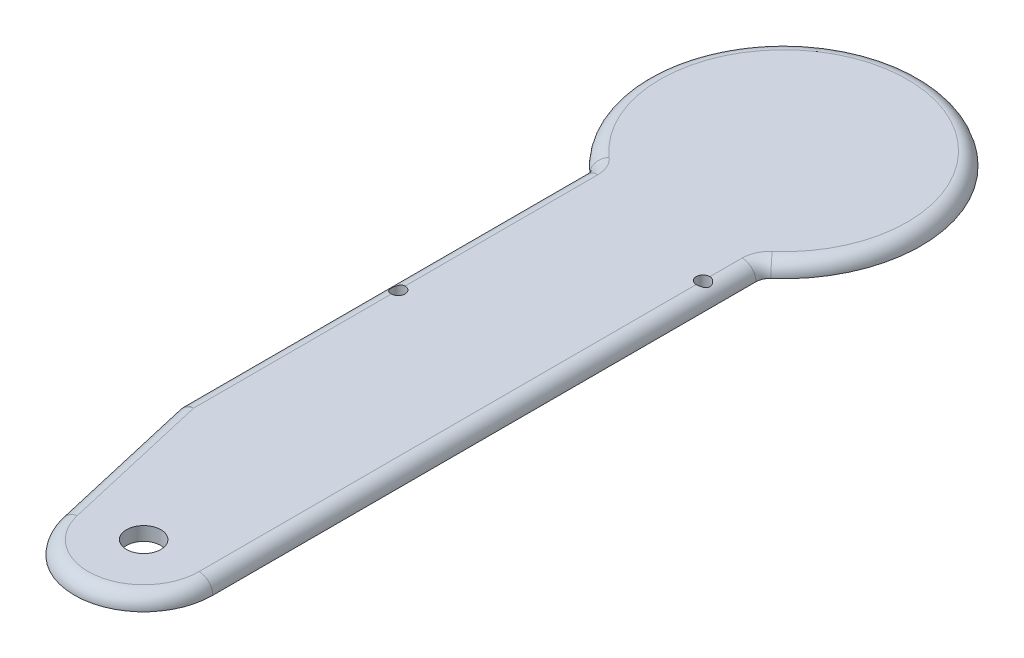
from build123d import *

# Parameters (mm, degrees)
SKETCH1_R           = 3.175
SKETCH1_R_2         = 1.27
BOSS_EXTRUDE1_DEPTH = 2.54
FILLET1_R           = 2.54
FILLET2_R           = 2.54


with BuildPart() as part:
    # Sketch1 → Boss-Extrude1 (new body)
    with BuildSketch(Plane(origin=(0, 0, 0), x_dir=(1, 0, 0), z_dir=(0, 1, 0))):
        with BuildLine():
            Line((-15.875, -19.827868645), (-15.875, -96.027868645))
            Line((-15.875, -96.027868645), (-9.362396438, -124.297332186))
            ThreePointArc((-9.362396438, -124.297332186), (4.537150087, -134.127868645), (15.875, -121.427868645))
            Line((15.875, -121.427868645), (15.875, -96.027868645))
            Line((15.875, -96.027868645), (15.875, -19.827868645))
            ThreePointArc((15.875, -19.827868645), (0, 25.4), (-15.875, -19.827868645))
        make_face()
        with Locations(Location((3.093174395, -121.427868645, 0), (0, 0, 270))):
            Circle(SKETCH1_R, mode=Mode.SUBTRACT)
        with Locations(Location((-13.335, -57.927868645, 0), (0, 0, 270))):
            Circle(SKETCH1_R_2, mode=Mode.SUBTRACT)
        with Locations(Location((13.335, -28.25059986, 0), (0, 0, 270))):
            Circle(SKETCH1_R_2, mode=Mode.SUBTRACT)
    extrude(amount=BOSS_EXTRUDE1_DEPTH)

    # Fillet1
    fillet1_edges = [part.edges().sort_by_distance(p)[0] for p in [
        (15.875, 1.27, 19.827868645),
        (-15.875, 1.27, 96.027868645),
        (-15.875, 1.27, 19.827868645),
    ]]
    fillet(fillet1_edges, radius=FILLET1_R)

    # Fillet2
    # the kernel refuses this fillet: 2.54 mm, written as the material it takes off along each edge
    with BuildSketch(Plane(origin=(-18.415, 2.54, 21.012647977), x_dir=(1, 0, 0), z_dir=(0, 0, 1))) as fillet2_piece_1:
        with BuildLine():
            CenterArc((2.54 + FILLET2_R, -FILLET2_R), FILLET2_R, 90, 90)
            Line((2.54 + FILLET2_R, 0), (2.54, 0))
            Line((2.54, 0), (2.54, -FILLET2_R))
        make_face()
    revolve(axis=Axis((-18.415, 2.54, 21.012647977), (0, 1, 0)), revolution_arc=48.769422845, mode=Mode.SUBTRACT)
    with BuildSketch(Plane(origin=(0, 2.54, 0), x_dir=(0.6590909090909091, 0, 0.7520632776261045), z_dir=(-0.7520632776261045, 0, 0.6590909090909091))) as fillet2_piece_2:
        with BuildLine():
            CenterArc((25.4 - FILLET2_R, -FILLET2_R), FILLET2_R, 0, 90)
            Line((25.4, -FILLET2_R), (25.4, 0))
            Line((25.4, 0), (25.4 - FILLET2_R, 0))
        make_face()
    revolve(axis=Axis((0, 2.54, 0), (0, 1, 0)), revolution_arc=277.53884569, mode=Mode.SUBTRACT)
    with BuildSketch(Plane(origin=(18.415, 2.54, 21.012647977), x_dir=(-1, 0, 0), z_dir=(0, 0, 1))) as fillet2_piece_3:
        with BuildLine():
            CenterArc((2.54 + FILLET2_R, FILLET2_R), FILLET2_R, 180, 90)
            Line((2.54, FILLET2_R), (2.54, 0))
            Line((2.54, 0), (2.54 + FILLET2_R, 0))
        make_face()
    revolve(axis=Axis((18.415, 2.54, 21.012647977), (0, -1, 0)), revolution_arc=48.769422845, mode=Mode.SUBTRACT)
    with BuildSketch(Plane(origin=(15.875, 2.54, 21.012647977), x_dir=(-1, 0, 0), z_dir=(0, 0, 1))) as fillet2_piece_4:
        with BuildLine():
            CenterArc((FILLET2_R, FILLET2_R), FILLET2_R, 180, 90)
            Line((0, FILLET2_R), (0, 0))
            Line((0, 0), (FILLET2_R, 0))
        make_face()
    extrude(amount=100.415220668, mode=Mode.SUBTRACT)
    with BuildSketch(Plane(origin=(3.093174395, 2.54, 121.427868645), x_dir=(-0.9744751037997539, 0, 0.2244955947774008), z_dir=(-0.2244955947774008, 0, -0.9744751037997539))) as fillet2_piece_5:
        with BuildLine():
            CenterArc((12.781825605 - FILLET2_R, -FILLET2_R), FILLET2_R, 0, 90)
            Line((12.781825605, -FILLET2_R), (12.781825605, 0))
            Line((12.781825605, 0), (12.781825605 - FILLET2_R, 0))
        make_face()
    revolve(axis=Axis((3.093174395, 2.54, 121.427868645), (0, 1, 0)), revolution_arc=167.026780897, mode=Mode.SUBTRACT)
    with BuildSketch(Plane(origin=(-15.810166764, 2.54, 96.309292317), x_dir=(0.9744751037997537, 0, -0.22449559477740183), z_dir=(0.22449559477740183, 0, 0.9744751037997537))) as fillet2_piece_6:
        with BuildLine():
            CenterArc((FILLET2_R, -FILLET2_R), FILLET2_R, 90, 90)
            Line((0, -FILLET2_R), (0, 0))
            Line((0, 0), (FILLET2_R, 0))
        make_face()
    extrude(amount=28.721144091, mode=Mode.SUBTRACT)
    with BuildSketch(Plane(origin=(-13.335, 2.54, 95.739073507), x_dir=(-1, 0, 0), z_dir=(0, 0, -1))) as fillet2_piece_7:
        with BuildLine():
            CenterArc((2.54 - FILLET2_R, -FILLET2_R), FILLET2_R, 0, 90)
            Line((2.54 - FILLET2_R, 0), (2.54, 0))
            Line((2.54, 0), (2.54, -FILLET2_R))
        make_face()
    revolve(axis=Axis((-13.335, 2.54, 95.739073507), (0, 1, 0)), revolution_arc=12.973219103, mode=Mode.SUBTRACT)
    with BuildSketch(Plane(origin=(-15.875, 2.54, 21.012647977), x_dir=(0, -1, 0), z_dir=(0, 0, 1))) as fillet2_piece_8:
        with BuildLine():
            CenterArc((FILLET2_R, FILLET2_R), FILLET2_R, 180, 90)
            Line((0, FILLET2_R), (0, 0))
            Line((0, 0), (FILLET2_R, 0))
        make_face()
    extrude(amount=74.72642553, mode=Mode.SUBTRACT)


solid = part.part
